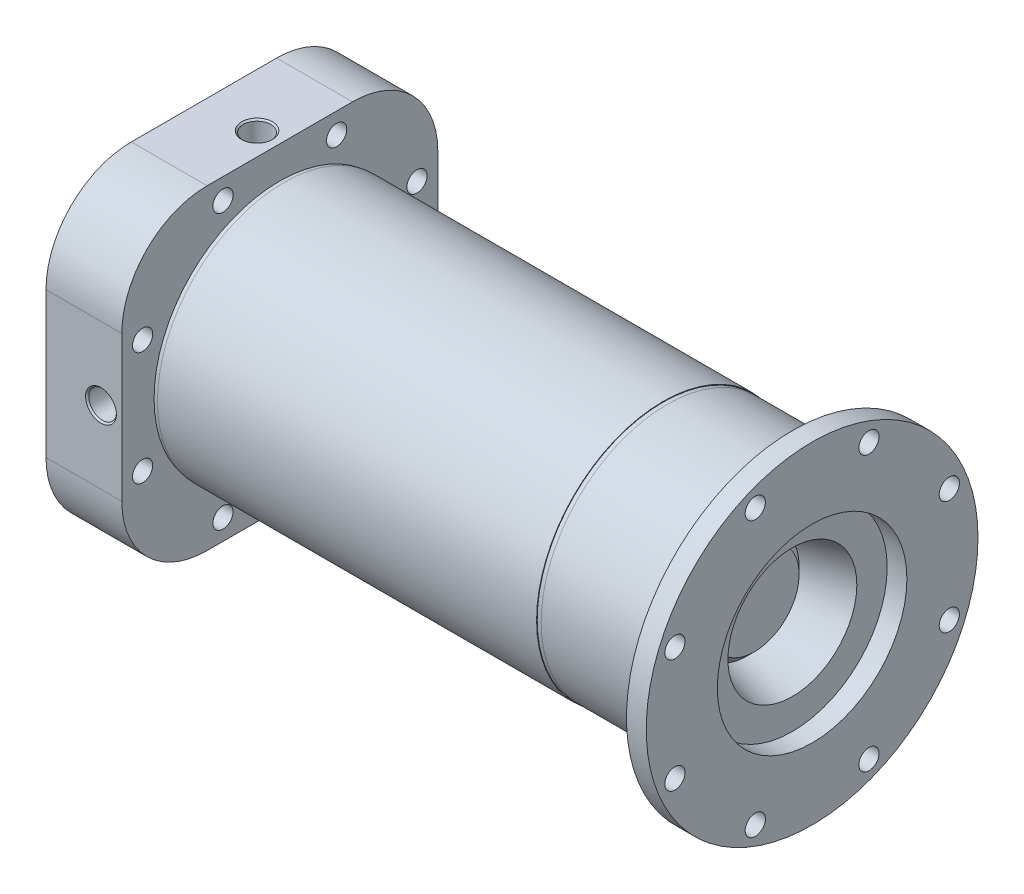
from build123d import *

# Parameters (mm, degrees)
FILLET1_R                = 1.27
CUT_EXTRUDE1_REACH       = 243.296
SKETCH2_R                = 3.81
CIRPATTERN1_COUNT        = 8
SKETCH4_R                = 63.5
BOSS_EXTRUDE1_DEPTH      = 31.75
SKETCH11_W               = 127
SKETCH11_H               = 127
BOSS_EXTRUDE2_DEPTH      = 31.75
SKETCH12_R               = 24.13
CUT_EXTRUDE4_DEPTH       = 16.51
CUT_EXTRUDE5_START       = -39.450428
SKETCH13_R               = 1.9685
CUT_EXTRUDE5_DEPTH       = 39.450428
CHAMFER1_SIZE            = 4.572
FILLET2_R                = 0.889
FILLET3_R                = 0.508
CUT_EXTRUDE9_REACH       = 267.18
CUT_EXTRUDE9_END_RADIUS  = 24.13
SKETCH31_R               = 1.5875
SKETCH37_W               = 127
SKETCH37_H               = 127
SKETCH37_R               = 43.688
CUT_EXTRUDE12_DEPTH      = 1.27
SKETCH32_R               = 69.85
SKETCH32_R_2             = 44.45
BOSS_EXTRUDE3_DEPTH      = 1.6002
SKETCH33_R               = 50.8
SKETCH33_R_2             = 44.45
BOSS_EXTRUDE4_DEPTH      = 152.4
BOSS_EXTRUDE5_START      = 154.0002
SKETCH32_2_R             = 69.85
SKETCH32_2_R_2           = 44.45
BOSS_EXTRUDE5_DEPTH      = 1.6002
FILLET4_R                = 0.254
FILLET5_R                = 1.27
FILLET6_R                = 34.29
CUT_EXTRUDE11_DEPTH      = 228.029206866
CUT_EXTRUDE11_DEPTH_BACK = 1.6002
SKETCH36_R               = 69.85
SKETCH36_R_2             = 50.546
SKETCH39_R               = 66.675
SKETCH39_R_2             = 38.1
BOSS_EXTRUDE6_DEPTH      = 7.9375
SKETCH40_R               = 4.064
CUT_EXTRUDE13_DEPTH      = 255.596964032
CIRPATTERN3_COUNT        = 8
FILLET7_R                = 3.81


# Read off the part's stored shape, not the designer's step: Ø6.7 (6.7) Diameter Hole1
with BuildPart() as part:
    # Chamber Revolve → Revolve1 (revolve)
    with BuildSketch(Plane.XY, mode=Mode.PRIVATE) as revolve1_sk:
        with BuildLine():
            Line((223.962313951, 63.5), (223.962313951, 25.908))
            Line((223.962313951, 25.908), (191.916500941, 17.321350283))
            ThreePointArc((191.916500941, 17.321350283), (190.601700192, 17.321350283), (189.463049342, 17.978750658))
            Line((189.463049342, 17.978750658), (173.5582, 33.8836))
            Line((173.5582, 33.8836), (0, 33.8836))
            Line((0, 33.8836), (0, 42.5196))
            Line((0, 42.5196), (3.8608, 42.5196))
            Line((3.8608, 42.5196), (3.8608, 48.5902))
            Line((3.8608, 48.5902), (0, 48.5902))
            Line((0, 48.5902), (0, 63.5))
            Line((0, 63.5), (10.16, 63.5))
            Line((10.16, 63.5), (10.16, 47.5996))
            Line((10.16, 47.5996), (24.13, 47.5996))
            Line((24.13, 47.5996), (24.13, 63.5))
            Line((24.13, 63.5), (223.962313951, 63.5))
        make_face()
    revolve(revolve1_sk.sketch.rotate(Axis((0, 0, 0), (1, 0, 0)), 90), axis=Axis((0, 0, 0), (1, 0, 0)))

    # Fillet1
    fillet1_edges = [part.edges().sort_by_distance(p)[0] for p in [
        (24.13, 0, -47.5996),
        (10.16, 0, -47.5996),
    ]]
    fillet(fillet1_edges, radius=FILLET1_R)

    # Sketch2 → Cut-Extrude1 (cut, up to next)
    with BuildSketch(Plane.ZY, mode=Mode.PRIVATE) as cut_extrude1_sk1:
        with Locations((-21.773156568, 52.565049882)):
            Circle(SKETCH2_R)
    cut_extrude1_tool1 = extrude(cut_extrude1_sk1.sketch, amount=-CUT_EXTRUDE1_REACH, mode=Mode.PRIVATE) & part.part
    cut_extrude1 = cut_extrude1_tool1.solids().sort_by_distance((0, 52.56505, -21.773157))[0]
    add(cut_extrude1, mode=Mode.SUBTRACT)

    # CirPattern1: Cut-Extrude1 ×8 about axis
    cirpattern1_axis = Axis((0, 0, 0), (1, 0, 0))
    for i in range(1, CIRPATTERN1_COUNT):
        add(cut_extrude1.rotate(cirpattern1_axis, i * 360 / CIRPATTERN1_COUNT), mode=Mode.SUBTRACT)

    # Fillet2
    fillet2_edges = [part.edges().sort_by_distance(p)[0] for p in [
        (3.8608, 0, -42.5196),
        (3.8608, 0, -48.5902),
    ]]
    fillet(fillet2_edges, radius=FILLET2_R)


with BuildPart() as body_2:
    # Sketch4 → Boss-Extrude1 (new body)
    with BuildSketch(Plane.ZY):
        Circle(SKETCH4_R)
    extrude(amount=BOSS_EXTRUDE1_DEPTH)

    # Sketch11 → Boss-Extrude2 (add)
    with BuildSketch(Plane.ZY.offset(31.75)):
        Rectangle(SKETCH11_W, SKETCH11_H)
    extrude(amount=-BOSS_EXTRUDE2_DEPTH)

    # Sketch12 → Cut-Extrude4 (cut)
    with BuildSketch(Plane(origin=(0, 0, 0), x_dir=(0, 0, -1), z_dir=(1, 0, 0))):
        Circle(SKETCH12_R)
    extrude(amount=-CUT_EXTRUDE4_DEPTH, mode=Mode.SUBTRACT)

    # Sketch13 → Cut-Extrude5 (cut)
    with BuildSketch(Plane.XY.offset(63.5).offset(CUT_EXTRUDE5_START)):
        with Locations((-9.652, 0)):
            Circle(SKETCH13_R)
    cut_extrude5 = extrude(amount=CUT_EXTRUDE5_DEPTH, mode=Mode.SUBTRACT)

    # Chamfer1
    chamfer1_edges = [body_2.edges().sort_by_distance(p)[0] for p in [
        (0, 0, 24.13),
    ]]
    chamfer(chamfer1_edges, length=CHAMFER1_SIZE)

    # Sketch20 → 7/16 (0.4375) Diameter Hole1 (revolve, cut)
    with BuildSketch(Plane(origin=(-9.652, 0, 63.5), x_dir=(0, -1, 0), z_dir=(1, 0, 0))):
        Polygon((0, 0), (0, 22.388531814), (5.55625, 19.05), (5.55625, 0.635), (6.19125, 0), align=None)
    f_7_16_0_4375_diameter_hole1 = revolve(axis=Axis((-9.652, 0, 69.85), (0, 0, -1)), mode=Mode.SUBTRACT)

    # Mirror1: Cut-Extrude5, 7/16 (0.4375) Diameter Hole1 across plane
    add(cut_extrude5.mirror(Plane.XY), mode=Mode.SUBTRACT)
    add(f_7_16_0_4375_diameter_hole1.mirror(Plane.XY), mode=Mode.SUBTRACT)

    # Ø6.7 (6.7) Diameter Hole1 outline → Ø6.7 (6.7) Diameter Hole1 (revolve, cut)
    with BuildSketch(Plane(origin=(0, -33.02, 0), x_dir=(0, 1, 0), z_dir=(0, 0, -1))):
        Polygon((3.35, -16.256), (0, -14.243116926), (0, -31.75), (3.75, -31.75), (3.35, -31.35), align=None)
    f_6_7_6_7_diameter_hole1 = revolve(axis=Axis((0, -33.02, 0), (1, 0, 0)), mode=Mode.SUBTRACT)

    # Mirror2: Ø6.7 (6.7) Diameter Hole1 across plane
    add(f_6_7_6_7_diameter_hole1.mirror(Plane.ZX), mode=Mode.SUBTRACT)

    # Sketch24 → Cut-Revolve1 (revolve, cut)
    with BuildSketch(Plane(origin=(0, 0, 0), x_dir=(1, 0, 0), z_dir=(0, 1, 0))):
        with BuildLine():
            Line((-31.75, 7.1374), (-30.958106371, 5.7658))
            Line((-30.958106371, 5.7658), (-29.845, 5.7658))
            ThreePointArc((-29.845, 5.7658), (-29.650596816, 5.727130803), (-29.485789755, 5.617010245))
            Line((-29.485789755, 5.617010245), (-28.73287951, 4.8641))
            Line((-28.73287951, 4.8641), (-16.51, 4.8641))
            Line((-16.51, 4.8641), (-16.51, 0))
            Line((-16.51, 0), (-31.75, 0))
            Line((-31.75, 0), (-31.75, 7.1374))
        make_face()
    revolve(axis=Axis((223.962313951, 0, 0), (-1, 0, 0)), mode=Mode.SUBTRACT)

    # Fillet3
    fillet3_edges = [body_2.edges().sort_by_distance(p)[0] for p in [
        (-30.958106371, 0, 5.7658),
    ]]
    fillet(fillet3_edges, radius=FILLET3_R)

    # Sketch30 → 7/16 (0.4375) Diameter Hole2 (revolve, cut)
    with BuildSketch(Plane(origin=(-10.414, -63.5, 0), x_dir=(0, 0, -1), z_dir=(1, 0, 0))):
        Polygon((0, 0), (0, 22.388531814), (5.55625, 19.05), (5.55625, 0.635), (6.19125, 0), align=None)
    f_7_16_0_4375_diameter_hole2 = revolve(axis=Axis((-10.414, -69.85, 0), (0, 1, 0)), mode=Mode.SUBTRACT)

    # Cut-Extrude9: up to this cylinder (the profile starts outside it)
    cut_extrude9_end = Plane(origin=(-10.414, 0, 0), z_dir=(1, 0, 0)) * Cylinder(CUT_EXTRUDE9_END_RADIUS, 583.62, mode=Mode.PRIVATE)
    # Sketch31 → Cut-Extrude9 (cut, up to the surface)
    with BuildSketch(Plane.XZ.offset(63.5), mode=Mode.PRIVATE) as cut_extrude9_sk1:
        with Locations(Location((-10.414, 0, 0), (0, 0, 270))):
            Circle(SKETCH31_R)
    cut_extrude9_tool1 = extrude(cut_extrude9_sk1.sketch, amount=-CUT_EXTRUDE9_REACH, mode=Mode.PRIVATE) - cut_extrude9_end
    cut_extrude9 = cut_extrude9_tool1.solids().sort_by_distance((-10.414, -63.5, 0))[0]
    add(cut_extrude9, mode=Mode.SUBTRACT)

    # Mirror3: 7/16 (0.4375) Diameter Hole2, Cut-Extrude9 across plane
    add(f_7_16_0_4375_diameter_hole2.mirror(Plane.ZX), mode=Mode.SUBTRACT)
    add(cut_extrude9.mirror(Plane.ZX), mode=Mode.SUBTRACT)

    # Sketch37 → Cut-Extrude12 (cut)
    with BuildSketch(Plane(origin=(0, 0, 0), x_dir=(0, 0, -1), z_dir=(1, 0, 0))):
        Rectangle(SKETCH37_W, SKETCH37_H)
        Circle(SKETCH37_R, mode=Mode.SUBTRACT)
    extrude(amount=-CUT_EXTRUDE12_DEPTH, mode=Mode.SUBTRACT)

    # Fillet6
    fillet6_edges = [body_2.edges().sort_by_distance(p)[0] for p in [
        (-16.51, 63.5, 63.5),
        (-16.51, -63.5, 63.5),
        (-16.51, -63.5, -63.5),
        (-16.51, 63.5, -63.5),
    ]]
    fillet(fillet6_edges, radius=FILLET6_R)


with BuildPart() as body_3:
    # Sketch21 → Revolve2 (revolve)
    with BuildSketch(Plane(origin=(0, 0, 0), x_dir=(1, 0, 0), z_dir=(0, 1, 0))):
        Polygon((0, 33.8836), (173.5582, 33.8836), (189.463049342, 17.978750658), (189.463049342, 0), (0, 0), align=None)
    revolve(axis=Axis((189.463049342, 0, 0), (1, 0, 0)))


with BuildPart() as body_3_2:
    # Sketch32 → Boss-Extrude3 (new body)
    with BuildSketch(Plane(origin=(-1.27, 0, 0), x_dir=(0, 0, -1), z_dir=(1, 0, 0))):
        Circle(SKETCH32_R)
        Circle(SKETCH32_R_2, mode=Mode.SUBTRACT)
    extrude(amount=BOSS_EXTRUDE3_DEPTH)


with BuildPart() as body_4:
    # Sketch33 → Boss-Extrude4 (new body)
    with BuildSketch(Plane(origin=(0.3302, 0, 0), x_dir=(0, 0, -1), z_dir=(1, 0, 0))):
        with Locations(Location((0, 0, 0), (0, 0, 180))):
            Circle(SKETCH33_R)
        with Locations(Location((0, 0, 0), (0, 0, 180))):
            Circle(SKETCH33_R_2, mode=Mode.SUBTRACT)
    extrude(amount=BOSS_EXTRUDE4_DEPTH)


with BuildPart() as body_5:
    # Sketch32<2> → Boss-Extrude5 (new body)
    with BuildSketch(Plane(origin=(-1.27, 0, 0), x_dir=(0, 0, -1), z_dir=(1, 0, 0)).offset(BOSS_EXTRUDE5_START)):
        Circle(SKETCH32_2_R)
        Circle(SKETCH32_2_R_2, mode=Mode.SUBTRACT)
    extrude(amount=BOSS_EXTRUDE5_DEPTH)


with BuildPart() as body_6:
    # Sketch34 → Revolve3 (revolve)
    with BuildSketch(Plane.XY, mode=Mode.PRIVATE) as revolve3_sk:
        Polygon((154.3304, 50.546), (154.3304, 43.688), (151.7904, 43.688), (151.7904, 41.148), (154.3304, 41.148), (171.279763711, 16.9418), (204.742077662, 25.908), (204.742077662, 50.546), align=None)
    revolve(revolve3_sk.sketch.rotate(Axis((152.7302, 0, 0), (-1, 0, 0)), 90), axis=Axis((152.7302, 0, 0), (-1, 0, 0)))

    # Fillet4
    fillet4_edges = [body_6.edges().sort_by_distance(p)[0] for p in [
        (154.3304, 0, 43.688),
    ]]
    fillet(fillet4_edges, radius=FILLET4_R)

    # Fillet5
    fillet5_edges = [body_6.edges().sort_by_distance(p)[0] for p in [
        (171.279763711, 0, 16.9418),
    ]]
    fillet(fillet5_edges, radius=FILLET5_R)

    # Fillet7
    fillet7_edges = [body_6.edges().sort_by_distance(p)[0] for p in [
        (154.3304, 0, 41.148),
    ]]
    fillet(fillet7_edges, radius=FILLET7_R)


with BuildPart() as cut_extrude11_tool:
    # Sketch36 → Cut-Extrude11 (new, two sides: drawn at the far end of the back side and taken through both)
    with BuildSketch(Plane(origin=(0.3302, 0, 0), x_dir=(0, 0, -1), z_dir=(1, 0, 0)).offset(-CUT_EXTRUDE11_DEPTH_BACK)):
        Circle(SKETCH36_R)
        Circle(SKETCH36_R_2, mode=Mode.SUBTRACT)
    extrude(amount=CUT_EXTRUDE11_DEPTH + CUT_EXTRUDE11_DEPTH_BACK)


with BuildPart() as body_3_2_1:
    add(body_3_2.part)

    # Cut-Extrude11: cut by cut_extrude11_tool
    add(cut_extrude11_tool.part, mode=Mode.SUBTRACT)


with BuildPart() as body_5_1:
    add(body_5.part)

    # Cut-Extrude11: cut by cut_extrude11_tool
    add(cut_extrude11_tool.part, mode=Mode.SUBTRACT)


with BuildPart() as body_7:
    # Sketch39 → Boss-Extrude6 (new body)
    with BuildSketch(Plane(origin=(204.742077662, 0, 0), x_dir=(0, 0, -1), z_dir=(1, 0, 0))):
        Circle(SKETCH39_R)
        Circle(SKETCH39_R_2, mode=Mode.SUBTRACT)
    extrude(amount=BOSS_EXTRUDE6_DEPTH)


with BuildPart() as cut_extrude13_tool:
    # Sketch40 → Cut-Extrude13 (new, symmetric)
    with BuildSketch(Plane.ZY.offset(-204.742077662)):
        with Locations(Location((-22.842374078, 55.146369296, 0), (0, 0, 180))):
            Circle(SKETCH40_R)
    cut_extrude13 = extrude(amount=CUT_EXTRUDE13_DEPTH, both=True)


with BuildPart() as body_2_1:
    add(body_2.part)

    # Cut-Extrude13: cut by cut_extrude13_tool
    add(cut_extrude13_tool.part, mode=Mode.SUBTRACT)


with BuildPart() as body_7_1:
    add(body_7.part)

    # Cut-Extrude13: cut by cut_extrude13_tool
    add(cut_extrude13_tool.part, mode=Mode.SUBTRACT)


with BuildPart() as cirpattern3_tool:
    # CirPattern3: Cut-Extrude13 ×8 about axis
    cirpattern3_axis = Axis((0, 0, 0), (1, 0, 0))
    for i in range(1, CIRPATTERN3_COUNT):
        add(cut_extrude13.rotate(cirpattern3_axis, i * 360 / CIRPATTERN3_COUNT))


with BuildPart() as body_2_2:
    add(body_2_1.part)

    # CirPattern3: cut by cirpattern3_tool
    add(cirpattern3_tool.part, mode=Mode.SUBTRACT)


with BuildPart() as body_7_2:
    add(body_7_1.part)

    # CirPattern3: cut by cirpattern3_tool
    add(cirpattern3_tool.part, mode=Mode.SUBTRACT)


solid = Compound([body_3.part, body_4.part, body_6.part, body_3_2_1.part, body_5_1.part, body_2_2.part, body_7_2.part])
